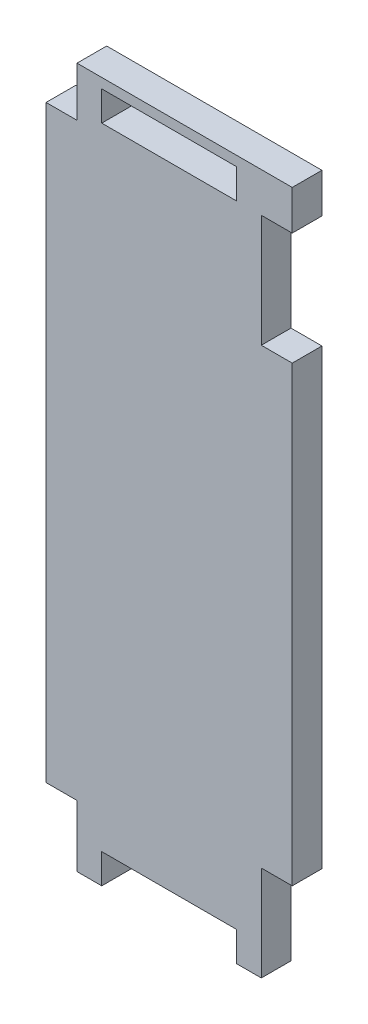
from build123d import *

# Parameters (mm, degrees)
SKETCH1_W           = 13.843
SKETCH1_H           = 3.048
BOSS_EXTRUDE1_DEPTH = 3.048


with BuildPart() as part:
    # Sketch1 → Boss-Extrude1 (new body)
    with BuildSketch(Plane.XY):
        Polygon((-3.175, 6.731), (0, 6.731), (0, 53.213), (-3.175, 53.213), (-3.175, 64.77), (0, 64.77), (0, 68.834), (-22.098, 68.834), (-22.098, 63.754), (-25.273, 63.754), (-25.273, 3.2766), (-22.098, 3.2766), (-22.098, -3.048), (-19.558, -3.048), (-19.558, 0), (-5.715, 0), (-5.715, -3.048), (-3.175, -3.048), (-3.175, 6.35), align=None)
        with Locations((-12.6365, 66.294)):
            Rectangle(SKETCH1_W, SKETCH1_H, mode=Mode.SUBTRACT)
    extrude(amount=BOSS_EXTRUDE1_DEPTH)


solid = part.part
